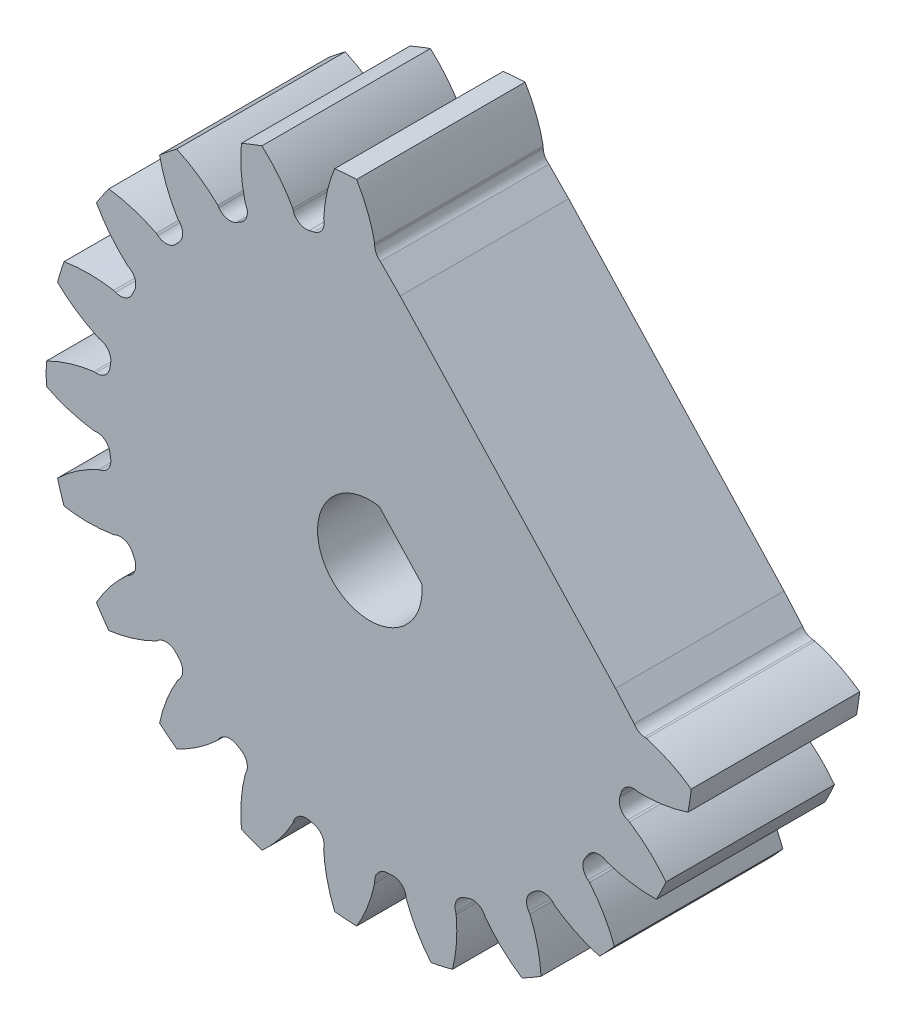
from build123d import *

# Parameters (mm, degrees)
SKETCH1_R                = 24.384
BOSS_EXTRUDE1_DEPTH      = 25.4
SKETCH2_W                = 15.748
SKETCH2_H                = 17.78
FILLET2_R                = 0.48768
CUT_EXTRUDE1_DEPTH       = 54.687212825
FILLET1_R                = 0.997458
CIRPATTERN1_COUNT        = 21
FILLET1_OF_CIRPATTERN1_R = 0.997458
SKETCH5_R                = 3.937
CUT_EXTRUDE2_DEPTH       = 54.677980168
CHAMFER1_SIZE            = 0.889
SKETCH6_R                = 34.013652427
CUT_EXTRUDE3_DEPTH       = 21.59
SKETCH7_R                = 30.749213908
CUT_EXTRUDE4_DEPTH       = 6.858
SKETCH8_W                = 7.62
SKETCH8_H                = 12.7
CUT_REVOLVE1_ANGLE       = 85.714285714
CUT_EXTRUDE5_DEPTH       = 37.734964999
BOSS_EXTRUDE2_DEPTH      = 12.7
SKETCH23_W               = 14.054404403
SKETCH23_H               = 28.582712692
CUT_EXTRUDE6_DEPTH       = 1.651


with BuildPart() as part:
    # Sketch1 → Boss-Extrude1 (new body)
    with BuildSketch(Plane.XY):
        Circle(SKETCH1_R)
    extrude(amount=-BOSS_EXTRUDE1_DEPTH)

    # Sketch2 → Revolve1 (revolve)
    with BuildSketch(Plane(origin=(0, 0, 0), x_dir=(0, 0, -1), z_dir=(1, 0, 0)), mode=Mode.PRIVATE) as revolve1_sk:
        with Locations((33.274, 8.89)):
            Rectangle(SKETCH2_W, SKETCH2_H)
    revolve(revolve1_sk.sketch.rotate(Axis((0, 0, -25.4), (0, 0, -1)), 90), axis=Axis((0, 0, -25.4), (0, 0, -1)))

    # Fillet2
    fillet2_edges = [part.edges().sort_by_distance(p)[0] for p in [
        (-24.384, 0, 0),
        (-24.384, 0, -25.4),
        (-17.78, 0, -25.4),
    ]]
    fillet(fillet2_edges, radius=FILLET2_R)

    # Sketch4 → Cut-Extrude1 (cut, through all)
    with BuildSketch(Plane.XY):
        with BuildLine():
            Line((0.368941123, 20.881409451), (0.368941123, 19.772574887))
            ThreePointArc((0.368941123, 19.772574887), (1.477867026, 19.720718655), (2.582135873, 19.60671848))
            Line((2.582135873, 19.60671848), (2.747399473, 20.70316822))
            add(Edge.make_bspline(
                [(10.125515203, 27.759935137), (4.561273711, 25.547998678), (2.747399473, 20.70316822)],
                knots=[0, 0, 0, 1, 1, 1], degree=2))
            ThreePointArc((10.125515203, 27.759935137), (2.208200461, 29.46631819), (-5.875007792, 28.959011385))
            add(Edge.make_bspline(
                [(-5.875007792, 28.959011385), (-0.702587358, 25.942471458), (0.368941123, 20.881409451)],
                knots=[0, 0, 0, 1, 1, 1], degree=2))
        make_face()
    cut_extrude1 = extrude(amount=-CUT_EXTRUDE1_DEPTH, mode=Mode.SUBTRACT)

    # Fillet1
    fillet1_edges = [part.edges().sort_by_distance(p)[0] for p in [
        (2.582135873, 19.60671848, -12.7),
        (0.368941123, 19.772574887, -12.7),
    ]]
    fillet(fillet1_edges, radius=FILLET1_R)

    # CirPattern1: Cut-Extrude1 ×21 about axis
    cirpattern1_axis = Axis((0, 0, -25.4), (0, 0, 1))
    for i in range(1, CIRPATTERN1_COUNT):
        add(cut_extrude1.rotate(cirpattern1_axis, i * 360 / CIRPATTERN1_COUNT), mode=Mode.SUBTRACT)

    # Fillet1 of CirPattern1
    fillet1_of_cirpattern1_edges = [part.edges().sort_by_distance(p)[0] for p in [
        (-3.311762904, 19.496744899, -12.7),
        (-5.475518655, 19.002882167, -12.7),
        (-8.911397014, 17.654399975, -12.7),
        (-10.833454572, 16.544699974, -12.7),
        (-13.719214391, 14.243384137, -12.7),
        (-15.228790508, 12.616448583, -12.7),
        (-17.308019365, 9.566781113, -12.7),
        (-18.270981577, 7.56717037, -12.7),
        (-19.358930863, 4.040127604, -12.7),
        (-19.689715752, 1.84551586, -12.7),
        (-19.689716398, -1.845508972, -12.7),
        (-19.358932276, -4.040120832, -12.7),
        (-18.270984224, -7.567163978, -12.7),
        (-17.308022712, -9.566775058, -12.7),
        (-15.228794922, -12.616443256, -12.7),
        (-13.719219374, -14.243379338, -12.7),
        (-10.83346036, -16.544696184, -12.7),
        (-8.91140319, -17.654396857, -12.7),
        (-5.475525303, -19.002880252, -12.7),
        (-3.311769725, -19.496743741, -12.7),
        (0.368934206, -19.772575016, -12.7),
        (2.582129014, -19.606719383, -12.7),
        (6.180612292, -18.785389719, -12.7),
        (8.246594258, -17.974551965, -12.7),
        (11.443115852, -16.129040108, -12.7),
        (13.178313413, -14.745266725, -12.7),
        (15.688848352, -12.039554502, -12.7),
        (16.939081589, -10.205799828, -12.7),
        (18.540557826, -6.880301643, -12.7),
        (19.194738029, -4.759502829, -12.7),
        (19.744857373, -1.10970379, -12.7),
        (19.744857762, 1.109696883, -12.7),
        (19.194739694, 4.759496114, -12.7),
        (18.540560233, 6.880295157, -12.7),
        (16.939085159, 10.205793903, -12.7),
        (15.688852563, 12.039549013, -12.7),
        (13.178318571, 14.745262115, -12.7),
        (11.443121494, 16.129036105, -12.7),
        (8.246600546, 17.97454908, -12.7),
        (6.180618863, 18.785387557, -12.7),
    ]]
    fillet(fillet1_of_cirpattern1_edges, radius=FILLET1_OF_CIRPATTERN1_R)

    # Sketch5 → Cut-Extrude2 (cut, through all)
    with BuildSketch(Plane.XY):
        Circle(SKETCH5_R)
    extrude(amount=-CUT_EXTRUDE2_DEPTH, mode=Mode.SUBTRACT)

    # Chamfer1
    chamfer1_edges = [part.edges().sort_by_distance(p)[0] for p in [
        (-17.78, 0, -41.148),
        (-3.937, 0, -41.148),
        (-3.937, 0, 0),
    ]]
    chamfer(chamfer1_edges, length=CHAMFER1_SIZE)

    # Sketch6 → Cut-Extrude3 (cut)
    with BuildSketch(Plane(origin=(0, 0, -41.148), x_dir=(-1, 0, 0), z_dir=(0, 0, -1))):
        Circle(SKETCH6_R)
    extrude(amount=-CUT_EXTRUDE3_DEPTH, mode=Mode.SUBTRACT)

    # Sketch7 → Cut-Extrude4 (cut)
    with BuildSketch(Plane.XY):
        Circle(SKETCH7_R)
    extrude(amount=-CUT_EXTRUDE4_DEPTH, mode=Mode.SUBTRACT)

    # Sketch8 → Cut-Revolve1 (revolve, cut)
    with BuildSketch(Plane(origin=(0, 0, 0), x_dir=(1, 0, 0), z_dir=(0, 1, 0))):
        with Locations((23.586016667, 13.208)):
            Rectangle(SKETCH8_W, SKETCH8_H)
    revolve(axis=Axis((0, 0, -25.4), (0, 0, 1)), revolution_arc=CUT_REVOLVE1_ANGLE, mode=Mode.SUBTRACT)

    # Sketch10 → Cut-Extrude5 (cut, through all)
    with BuildSketch(Plane.XY.offset(-6.858)):
        Polygon((-0.995625843, 24.363665266), (24.22113532, -2.81354933), (27.105228969, -0.137502435), (1.888467806, 27.03971216), align=None)
    extrude(amount=-CUT_EXTRUDE5_DEPTH, mode=Mode.SUBTRACT)

    # Sketch11 → Boss-Extrude2 (add)
    with BuildSketch(Plane.XY.offset(-6.858)):
        Polygon((0.717708085, 3.871028817), (3.913839177, 0.426417513), (5.511904723, 1.909205127), (2.315773631, 5.353816432), align=None)
    extrude(amount=-BOSS_EXTRUDE2_DEPTH)

    # Sketch23 → Cut-Extrude6 (cut)
    with BuildSketch(Plane(origin=(11.612754738, 10.775057968, 0), x_dir=(0, 0, -1), z_dir=(0.7330519908019052, 0.6801726095494903, 0))):
        with Locations((13.31433279, 0.012079444)):
            Rectangle(SKETCH23_W, SKETCH23_H)
    extrude(amount=-CUT_EXTRUDE6_DEPTH, mode=Mode.SUBTRACT)

    # Chamfer2
    # the kernel refuses this chamfer: 2.54, 1.800406997 mm, written as the material it takes off along each edge
    with BuildSketch(Plane(origin=(19.827703584, -0.505879397, -1.787835791), x_dir=(-0.6790393256320979, 0.7341018963639214, 0), z_dir=(0, 0, -1))) as chamfer2_piece_1:
        with BuildLine():
            Line((2.028065684, 0), (-0.30242259, -0.068297381))
            Line((-0.30242259, -0.068297381), (-0.312929477, -0.018595818))
            ThreePointArc((-0.312929477, -0.018595818), (-0.159610843, -0.003146677), (-0.020736894, 0.046374791))
            Line((-0.020736894, 0.046374791), (7.848e-05, 0.050799939))
            ThreePointArc((7.848e-05, 0.050799939), (1.014108901, 0.049233389), (2.028144163, 0.050799939))
            Line((2.028144163, 0.050799939), (2.028065684, 0))
        make_face()
    extrude(amount=22.840328418, mode=Mode.SUBTRACT)
    with BuildSketch(Plane(origin=(0.977268219, 19.810065377, -1.787835791), x_dir=(0.681304270143722, -0.7320003357129901, 0), z_dir=(0, 0, -1))) as chamfer2_piece_2:
        with BuildLine():
            Line((2.028065684, 0), (-0.30242259, 0.068297381))
            Line((-0.30242259, 0.068297381), (-0.312929477, 0.018595818))
            ThreePointArc((-0.312929477, 0.018595818), (-0.159610843, 0.003146677), (-0.020736894, -0.046374791))
            Line((-0.020736894, -0.046374791), (7.848e-05, -0.050799939))
            ThreePointArc((7.848e-05, -0.050799939), (1.014108901, -0.049233389), (2.028144163, -0.050799939))
            Line((2.028144163, -0.050799939), (2.028065684, 0))
        make_face()
    extrude(amount=22.840328418, mode=Mode.SUBTRACT)


solid = part.part
